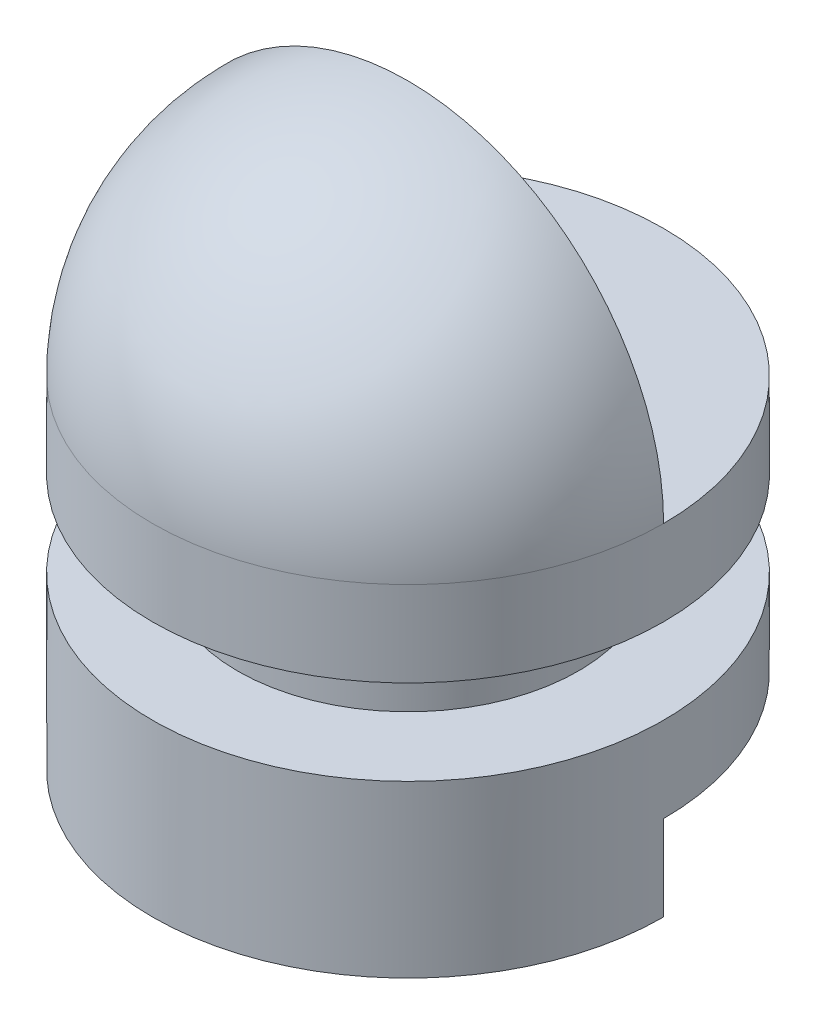
from build123d import *

# Parameters (mm, degrees)
SKETCH1_R           = 20
BOSS_EXTRUDE1_DEPTH = 10
SKETCH2_R           = 30
BOSS_EXTRUDE2_DEPTH = 10
BOSS_EXTRUDE3_START = 10
SKETCH3_R           = 30
BOSS_EXTRUDE3_DEPTH = 10
BOSS_EXTRUDE6_START = 10
BOSS_EXTRUDE6_DEPTH = 10
REVOLVE3_ANGLE      = 180


with BuildPart() as part:
    # Sketch1 → Boss-Extrude1 (new body)
    with BuildSketch(Plane(origin=(0, 0, 0), x_dir=(1, 0, 0), z_dir=(0, 1, 0))):
        Circle(SKETCH1_R)
    extrude(amount=BOSS_EXTRUDE1_DEPTH)

    # Sketch2 → Boss-Extrude2 (add)
    with BuildSketch(Plane(origin=(0, 10, 0), x_dir=(1, 0, 0), z_dir=(0, 1, 0))):
        Circle(SKETCH2_R)
    extrude(amount=BOSS_EXTRUDE2_DEPTH)

    # Sketch3 → Boss-Extrude3 (add)
    with BuildSketch(Plane.XZ.offset(BOSS_EXTRUDE3_START)):
        Circle(SKETCH3_R)
    extrude(amount=-BOSS_EXTRUDE3_DEPTH)

    # Sketch8 → Boss-Extrude6 (add)
    with BuildSketch(Plane(origin=(0, -10, 0), x_dir=(-1, 0, 0), z_dir=(0, -1, 0)).offset(BOSS_EXTRUDE6_START)):
        with BuildLine():
            Line((0, 0), (-30, 0))
            ThreePointArc((-30, 0), (0, -30), (30, 0))
            Line((30, 0), (0, 0))
        make_face()
    extrude(amount=-BOSS_EXTRUDE6_DEPTH)

    # Sketch6 → Revolve3 (revolve)
    with BuildSketch(Plane(origin=(0, 20, 0), x_dir=(1, 0, 0), z_dir=(0, 1, 0))):
        with BuildLine():
            Line((0, 0), (-30, 0))
            ThreePointArc((-30, 0), (-21.213203436, -21.213203436), (0, -30))
            Line((0, -30), (0, 0))
        make_face()
    revolve(axis=Axis((0, 20, 0), (0, 0, -1)), revolution_arc=REVOLVE3_ANGLE)


solid = part.part
